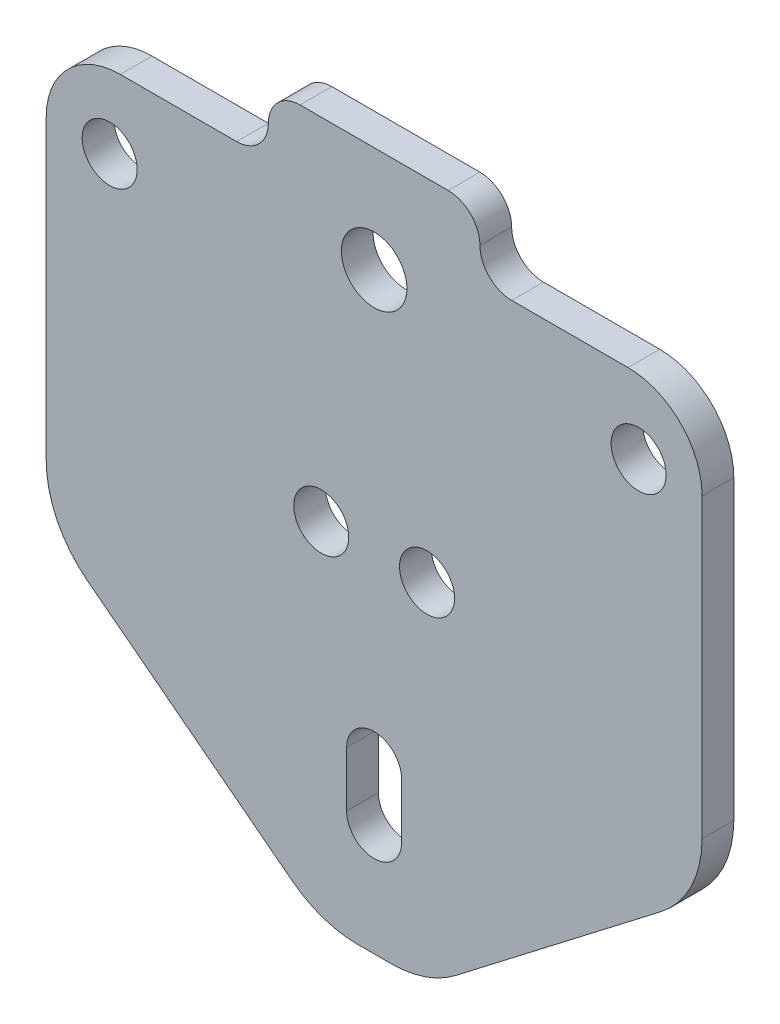
from build123d import *

# Parameters (mm, degrees)
SKETCH1_R          = 2.6
SKETCH1_R_2        = 3.1
BASE_FLANGE1_DEPTH = 3
FILLET_10_MM_R     = 10
FILLET1_R          = 7
FILLET2_START      = -4
FILLET2_DEPTH      = 5
FILLET2_START_2    = -3
FILLET2_2_DEPTH    = 3


with BuildPart() as part:
    # Base-Flange1: sheet metal written as solids
    # Sketch1 → Base-Flange1 (new body)
    with BuildSketch(Plane.XY):
        Polygon((-31, -5.857930586), (-10, -5.857930586), (-10, 0.142069414), (10, 0.142069414), (10, -5.857930586), (31, -5.857930586), (31, -45.857930586), (5, -65.857930586), (-5, -65.857930586), (-31, -45.857930586), align=None)
        with Locations((25, -12.857930586)):
            Circle(SKETCH1_R, mode=Mode.SUBTRACT)
        with Locations((-25, -12.857930586)):
            Circle(SKETCH1_R, mode=Mode.SUBTRACT)
        with Locations((0, -9.857930586)):
            Circle(SKETCH1_R_2, mode=Mode.SUBTRACT)
        with Locations((5, -32.957930586)):
            Circle(SKETCH1_R, mode=Mode.SUBTRACT)
        with Locations((-5, -32.957930586)):
            Circle(SKETCH1_R, mode=Mode.SUBTRACT)
        with BuildLine():
            Line((-2.6, -55.457930586), (-2.6, -50.257930586))
            ThreePointArc((-2.6, -50.257930586), (0, -47.657930586), (2.6, -50.257930586))
            Line((2.6, -50.257930586), (2.6, -55.457930586))
            ThreePointArc((2.6, -55.457930586), (0, -58.057930586), (-2.6, -55.457930586))
        make_face(mode=Mode.SUBTRACT)
    extrude(amount=-BASE_FLANGE1_DEPTH)

    # fillet 10 mm
    fillet_10_mm_edges = [part.edges().sort_by_distance(p)[0] for p in [
        (31, -45.857930586, -1.5),
        (5, -65.857930586, -1.5),
        (-5, -65.857930586, -1.5),
        (-31, -45.857930586, -1.5),
    ]]
    fillet(fillet_10_mm_edges, radius=FILLET_10_MM_R)

    # Fillet1
    fillet1_edges = [part.edges().sort_by_distance(p)[0] for p in [
        (31, -5.857930586, -1.5),
        (-31, -5.857930586, -1.5),
    ]]
    fillet(fillet1_edges, radius=FILLET1_R)

    # Fillet2: read off the stored shape, not the designer's step
    # Fillet2 outline → Fillet2 (cut)
    with BuildSketch(Plane.XY.offset(FILLET2_START)):
        with BuildLine():
            Line((-10, 0.142069414), (-10, -2.857930586))
            ThreePointArc((-10, -2.857930586), (-9.121320344, -0.736610242), (-7, 0.142069414))
            Line((-7, 0.142069414), (-10, 0.142069414))
        make_face()
        with BuildLine():
            Line((10, 0.142069414), (7, 0.142069414))
            ThreePointArc((7, 0.142069414), (9.121320344, -0.736610242), (10, -2.857930586))
            Line((10, -2.857930586), (10, 0.142069414))
        make_face()
    extrude(amount=FILLET2_DEPTH, mode=Mode.SUBTRACT)

    # Fillet2 2 outline → Fillet2 2 (add)
    with BuildSketch(Plane.XY.offset(FILLET2_START_2)):
        with BuildLine():
            Line((-10, -5.857930586), (-10, -2.857930586))
            ThreePointArc((-10, -2.857930586), (-10.878679656, -4.97925093), (-13, -5.857930586))
            Line((-13, -5.857930586), (-10, -5.857930586))
        make_face()
        with BuildLine():
            ThreePointArc((13, -5.857930586), (10.878679656, -4.97925093), (10, -2.857930586))
            Line((10, -2.857930586), (10, -5.857930586))
            Line((10, -5.857930586), (13, -5.857930586))
        make_face()
    extrude(amount=FILLET2_2_DEPTH)


solid = part.part
